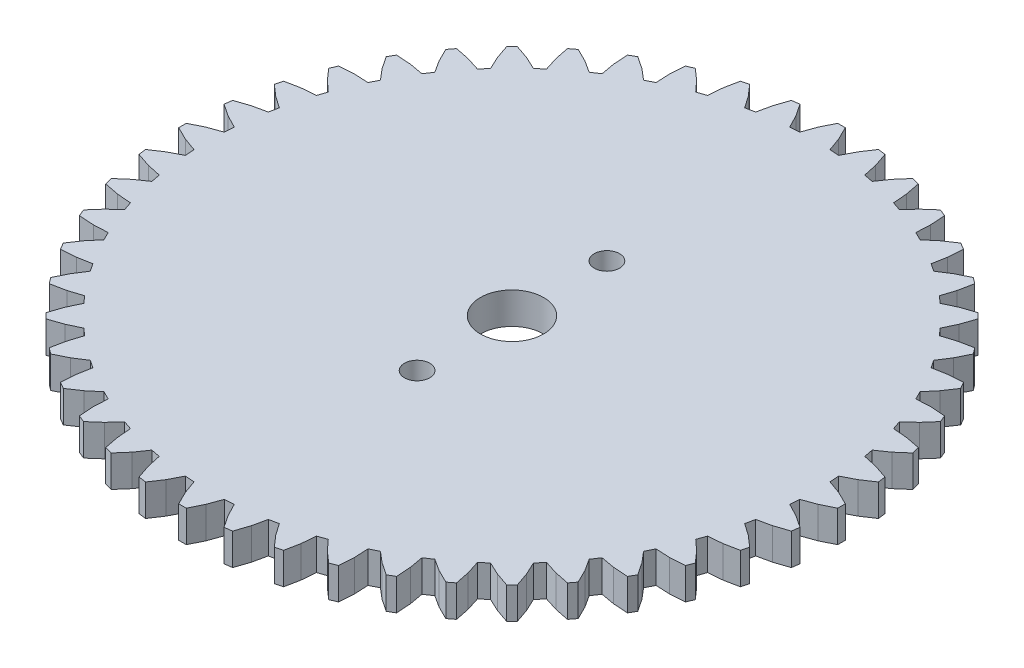
from build123d import *

# Parameters (mm, degrees)
BOSS_EXTRUDE2_DEPTH = 4
CUT_EXTRUDE1_REACH  = 67.976
SKETCH3_R           = 4
CUT_EXTRUDE2_REACH  = 67.976
SKETCH4_R           = 1.6


with BuildPart() as part:
    # Sketch1 → Boss-Extrude2 (new body)
    with BuildSketch(Plane(origin=(0, 0, 0), x_dir=(1, 0, 0), z_dir=(0, 1, 0))):
        Polygon((42.670768214, 7.33199203), (44.364090179, 6.722783745), (46.049296244, 5.897590381), (46.049296244, 4.930501415), (44.364090179, 4.10530805), (42.670768214, 3.496099765), (42.593668553, 2.318392566), (44.192872884, 1.493330462), (45.756080243, 0.455162666), (45.629761993, -0.503548343), (43.851224003, -1.101761341), (42.092976227, -1.484774504), (41.862723156, -2.64232275), (43.340583693, -3.668971144), (44.754826389, -4.902310618), (44.504546088, -5.836412796), (42.663045168, -6.197303661), (40.869846795, -6.347576757), (40.490498727, -7.465069617), (41.821751264, -8.676025199), (43.062944581, -10.083330557), (42.692890512, -10.976722901), (40.819973758, -11.094271266), (39.022455841, -11.009186038), (38.500557723, -12.067643121), (39.662294716, -13.441830895), (40.709232397, -14.999147756), (40.225688377, -15.836645304), (38.353556868, -15.7087561), (36.582480794, -15.389753168), (35.926802973, -16.37097933), (36.899389583, -17.885098897), (37.734007744, -19.56572336), (37.14535034, -20.332928251), (35.305944489, -19.96169562), (33.591678325, -19.414272165), (32.813478148, -20.30164275), (33.58002859, -21.929645586), (34.188189572, -23.704910872), (33.504368159, -24.388732285), (31.729102873, -23.780570839), (30.101100501, -23.01402086), (29.213729452, -23.792221038), (29.761152907, -25.506486738), (30.132385538, -27.345893053), (29.365180648, -27.934549993), (27.684556184, -27.099932296), (26.170436617, -26.127345222), (25.189210455, -26.783023506), (25.508213387, -28.554099581), (25.636103055, -30.426230626), (24.798605043, -30.90977511), (23.241288182, -29.862837428), (21.867100409, -28.701100436), (20.808643325, -29.222998554), (20.893728553, -31.020516471), (20.776180188, -32.893433225), (19.882787844, -33.263487293), (18.475482486, -32.022293977), (17.264527368, -30.69104144), (16.147034045, -31.070389508), (15.996760948, -32.863587881), (15.635870083, -34.705088337), (14.701767905, -34.955369102), (13.468428431, -33.541125942), (12.441780037, -32.063265869), (11.284231792, -32.293518476), (10.901218628, -34.051766716), (10.30300563, -35.830304706), (9.344294621, -35.956622956), (8.306126825, -34.393415597), (7.481064721, -32.794210802), (6.303357522, -32.871310927), (5.694149237, -34.564632892), (4.868955873, -36.249838957), (3.901866906, -36.249838957), (3.076674006, -34.564632892), (2.467465257, -32.871310927), (1.289758521, -32.794210802), (0.464695954, -34.393415597), (-0.573471379, -35.956622956), (-1.532182851, -35.830304706), (-2.130395385, -34.051766716), (-2.513408549, -32.293518476), (-3.670957258, -32.063265869), (-4.697605189, -33.541125942), (-5.930944663, -34.955369102), (-6.865046841, -34.705088337), (-7.22593817, -32.863587881), (-7.376211266, -31.070389508), (-8.493704125, -30.69104144), (-9.704659707, -32.022293977), (-11.111965066, -33.263487293), (-12.005356946, -32.893433225), (-12.122905311, -31.020516471), (-12.037820547, -29.222998554), (-13.096277166, -28.701100436), (-14.470464939, -29.862837428), (-16.0277818, -30.90977511), (-16.865279812, -30.426230626), (-16.737390608, -28.554099581), (-16.418387213, -26.783023506), (-17.399613375, -26.127345222), (-18.913732941, -27.099932296), (-20.594357869, -27.934549993), (-21.361562296, -27.345893053), (-20.990330128, -25.506486738), (-20.442906209, -23.792221038), (-21.330277258, -23.01402086), (-22.958280095, -23.780570839), (-24.733544916, -24.388732285), (-25.41736633, -23.704910872), (-24.809205347, -21.929645586), (-24.042655369, -20.30164275), (-24.820855546, -19.414272165), (-26.535121247, -19.96169562), (-28.374527561, -20.332928251), (-28.963184502, -19.56572336), (-28.128566341, -17.885098897), (-27.155979731, -16.37097933), (-27.811657551, -15.389753168), (-29.582734089, -15.7087561), (-31.454865135, -15.836645304), (-31.938409618, -14.999147756), (-30.891471473, -13.441830895), (-29.72973448, -12.067643121), (-30.251632599, -11.009186038), (-32.049150979, -11.094271266), (-33.92206727, -10.976722901), (-34.292121802, -10.083330557), (-33.050928022, -8.676025199), (-31.719675485, -7.465069617), (-32.099023553, -6.347576757), (-33.89222239, -6.197303661), (-35.733722846, -5.836412796), (-35.98400361, -4.902310618), (-34.569760451, -3.668971144), (-33.091899913, -2.64232275), (-33.322152985, -1.484774504), (-35.080401224, -1.101761341), (-36.858938751, -0.503548343), (-36.985257465, 0.455162666), (-35.422050106, 1.493330462), (-33.822845311, 2.318392566), (-33.899945435, 3.496099765), (-35.593266937, 4.10530805), (-37.278473002, 4.930501415), (-37.278473002, 5.897590381), (-35.593266937, 6.722783745), (-33.899945435, 7.33199203), (-33.822845311, 8.509698766), (-35.422050106, 9.334761333), (-36.985257465, 10.372928666), (-36.858938751, 11.331640138), (-35.080401224, 11.929852672), (-33.322152985, 12.3128663), (-33.091899913, 13.470414546), (-34.569760451, 14.49706294), (-35.98400361, 15.73040195), (-35.733722846, 16.664504128), (-33.89222239, 17.025395457), (-32.099023553, 17.175668553), (-31.719675485, 18.293161413), (-33.050928022, 19.504116994), (-34.292121802, 20.911422353), (-33.92206727, 21.804814697), (-32.049150979, 21.922362598), (-30.251632599, 21.837277834), (-29.72973448, 22.895734917), (-30.891471473, 24.269922226), (-31.938409618, 25.827239088), (-31.454865135, 26.664737099), (-29.582734089, 26.536847895), (-27.811657551, 26.2178445), (-27.155979731, 27.199070662), (-28.128566341, 28.713190692), (-28.963184502, 30.393815156), (-28.374527561, 31.161019583), (-26.535121247, 30.789787415), (-24.820855546, 30.24236396), (-24.042655369, 31.129734545), (-24.809205347, 32.757737382), (-25.41736633, 34.533002667), (-24.733544916, 35.216823617), (-22.958280095, 34.608662635), (-21.330277258, 33.842112656), (-20.442906209, 34.620312834), (-20.990330128, 36.334578534), (-21.361562296, 38.173984848), (-20.594357869, 38.762641789), (-18.913732941, 37.928023628), (-17.399613375, 36.955437018), (-16.418387213, 37.611114838), (-16.737390608, 39.382191376), (-16.865279812, 41.254322422), (-16.0277818, 41.737866905), (-14.470464939, 40.690929224), (-13.096277166, 39.529191768), (-12.037820547, 40.051089886), (-12.122905311, 41.848608266), (-12.005356946, 43.721524557), (-11.111965066, 44.091579089), (-9.704659707, 42.850385772), (-8.493704125, 41.519133236), (-7.376211266, 41.898481304), (-7.22593817, 43.691679677), (-6.865046841, 45.533180133), (-5.930944663, 45.783460897), (-4.697605189, 44.369217738), (-3.670957258, 42.891357201), (-2.513408549, 43.121610272), (-2.130395385, 44.879858512), (-1.532182851, 46.658396038), (-0.573471379, 46.784714752), (0.464695954, 45.221507393), (1.289758521, 43.622302598), (2.467465257, 43.699402722), (3.076674006, 45.392724688), (3.901866906, 47.077930289), (4.868955873, 47.077930289), (5.694149237, 45.392724688), (6.303357522, 43.699402722), (7.481064721, 43.622302598), (8.306126825, 45.221507393), (9.344294621, 46.784714752), (10.30300563, 46.658396038), (10.901218628, 44.879858512), (11.284231792, 43.121610272), (12.441780037, 42.891357201), (13.468428431, 44.369217738), (14.701767905, 45.783460897), (15.635870083, 45.533180133), (15.996760948, 43.691679677), (16.147034045, 41.898481304), (17.264527368, 41.519133236), (18.475482486, 42.850385772), (19.882787844, 44.091579089), (20.776180188, 43.721524557), (20.893728553, 41.848608266), (20.808643325, 40.051089886), (21.867100409, 39.529191768), (23.241288182, 40.690929224), (24.798605043, 41.737866905), (25.636103055, 41.254322422), (25.508213387, 39.382191376), (25.189210455, 37.611114838), (26.170436617, 36.955437018), (27.684556184, 37.928023628), (29.365180648, 38.762641789), (30.132385538, 38.173984848), (29.761152907, 36.334578534), (29.213729452, 34.620312834), (30.101100501, 33.842112656), (31.729102873, 34.608662635), (33.504368159, 35.216823617), (34.188189572, 34.533002667), (33.58002859, 32.757737382), (32.813478148, 31.129734545), (33.591678325, 30.24236396), (35.305944489, 30.789787415), (37.14535034, 31.161019583), (37.734007744, 30.393815156), (36.899389583, 28.713190692), (35.926802973, 27.199070662), (36.582480794, 26.2178445), (38.353556868, 26.536847895), (40.225688377, 26.664737099), (40.709232397, 25.827239088), (39.662294716, 24.269922226), (38.500557723, 22.895734917), (39.022455841, 21.837277834), (40.819973758, 21.922362598), (42.692890512, 21.804814697), (43.062944581, 20.911422353), (41.821751264, 19.504116994), (40.490498727, 18.293161413), (40.869846795, 17.175668553), (42.663045168, 17.025395457), (44.504546088, 16.664504128), (44.754826389, 15.73040195), (43.340583693, 14.49706294), (41.862723156, 13.470414546), (42.092976227, 12.3128663), (43.851224003, 11.929852672), (45.629761993, 11.331640138), (45.756080243, 10.372928666), (44.192872884, 9.334761333), (42.593668553, 8.509698766), align=None)
    extrude(amount=BOSS_EXTRUDE2_DEPTH)

    # Sketch3 → Cut-Extrude1 (cut, up to next)
    with BuildSketch(Plane(origin=(0, 0, 0), x_dir=(1, 0, 0), z_dir=(0, 1, 0)), mode=Mode.PRIVATE) as cut_extrude1_sk1:
        with Locations((4.385411621, 5.414045898)):
            Circle(SKETCH3_R)
    cut_extrude1_tool1 = extrude(cut_extrude1_sk1.sketch, amount=CUT_EXTRUDE1_REACH, mode=Mode.PRIVATE) & part.part
    add(cut_extrude1_tool1.solids().sort_by_distance((4.385412, 0, -5.414046))[0], mode=Mode.SUBTRACT)

    # Sketch4 → Cut-Extrude2 (cut, up to next)
    with BuildSketch(Plane(origin=(0, 0, 0), x_dir=(1, 0, 0), z_dir=(0, 1, 0)), mode=Mode.PRIVATE) as cut_extrude2_sk1:
        with Locations((4.385411389, 17.414045898)):
            Circle(SKETCH4_R)
    cut_extrude2_tool1 = extrude(cut_extrude2_sk1.sketch, amount=CUT_EXTRUDE2_REACH, mode=Mode.PRIVATE) & part.part
    # Sketch4 → Cut-Extrude2 (cut, up to next)
    with BuildSketch(Plane(origin=(0, 0, 0), x_dir=(1, 0, 0), z_dir=(0, 1, 0)), mode=Mode.PRIVATE) as cut_extrude2_sk2:
        with Locations((4.385411389, -6.585954102)):
            Circle(SKETCH4_R)
    cut_extrude2_tool2 = extrude(cut_extrude2_sk2.sketch, amount=CUT_EXTRUDE2_REACH, mode=Mode.PRIVATE) & part.part
    add(cut_extrude2_tool1.solids().sort_by_distance((4.385411, 0, -17.414046))[0], mode=Mode.SUBTRACT)
    add(cut_extrude2_tool2.solids().sort_by_distance((4.385411, 0, 6.585954))[0], mode=Mode.SUBTRACT)


solid = part.part
